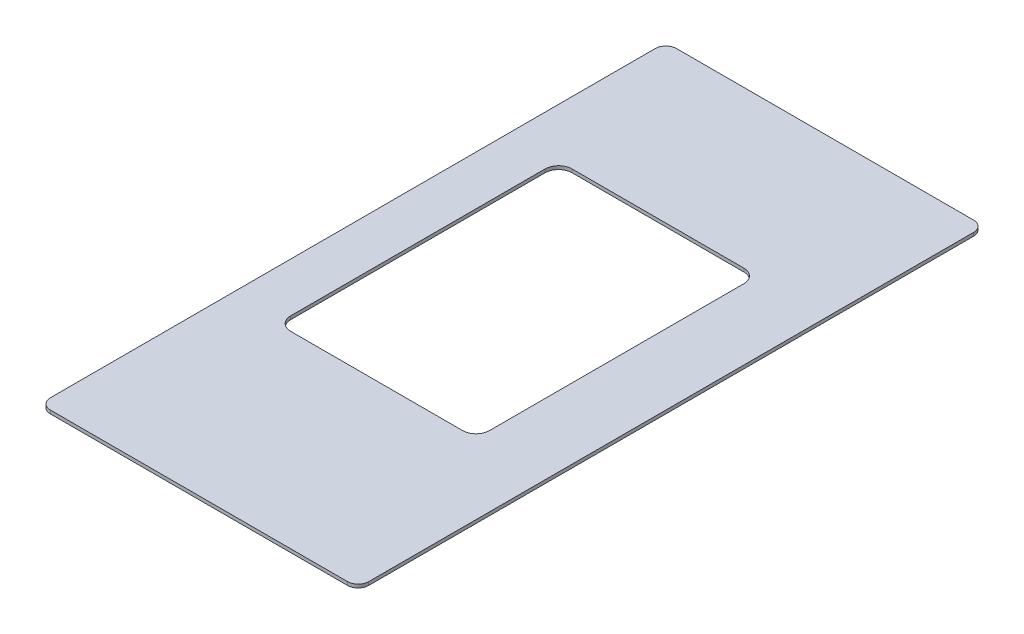
from build123d import *

# Parameters (mm, degrees)
SKETCH9_W           = 300
SKETCH9_H           = 590
SKETCH9_W_2         = 187.325
SKETCH9_H_2         = 265.1125
BOSS_EXTRUDE7_DEPTH = 3.175
FILLET4_R           = 10
FILLET5_R           = 12.7


with BuildPart() as part:
    # Sketch9 → Boss-Extrude7 (new body)
    with BuildSketch(Plane(origin=(0, 0, 0), x_dir=(1, 0, 0), z_dir=(0, 1, 0))):
        with Locations((0, 275)):
            Rectangle(SKETCH9_W, SKETCH9_H)
        with Locations((-10, 290)):
            Rectangle(SKETCH9_W_2, SKETCH9_H_2, mode=Mode.SUBTRACT)
    extrude(amount=BOSS_EXTRUDE7_DEPTH)

    # Fillet4
    fillet4_edges = [part.edges().sort_by_distance(p)[0] for p in [
        (-150, 1.5875, -570),
        (150, 1.5875, -570),
        (-150, 1.5875, 20),
        (150, 1.5875, 20),
    ]]
    fillet(fillet4_edges, radius=FILLET4_R)

    # Fillet5
    fillet5_edges = [part.edges().sort_by_distance(p)[0] for p in [
        (-103.6625, 1.5875, -157.44375),
        (83.6625, 1.5875, -157.44375),
        (83.6625, 1.5875, -422.55625),
        (-103.6625, 1.5875, -422.55625),
    ]]
    fillet(fillet5_edges, radius=FILLET5_R)


solid = part.part
